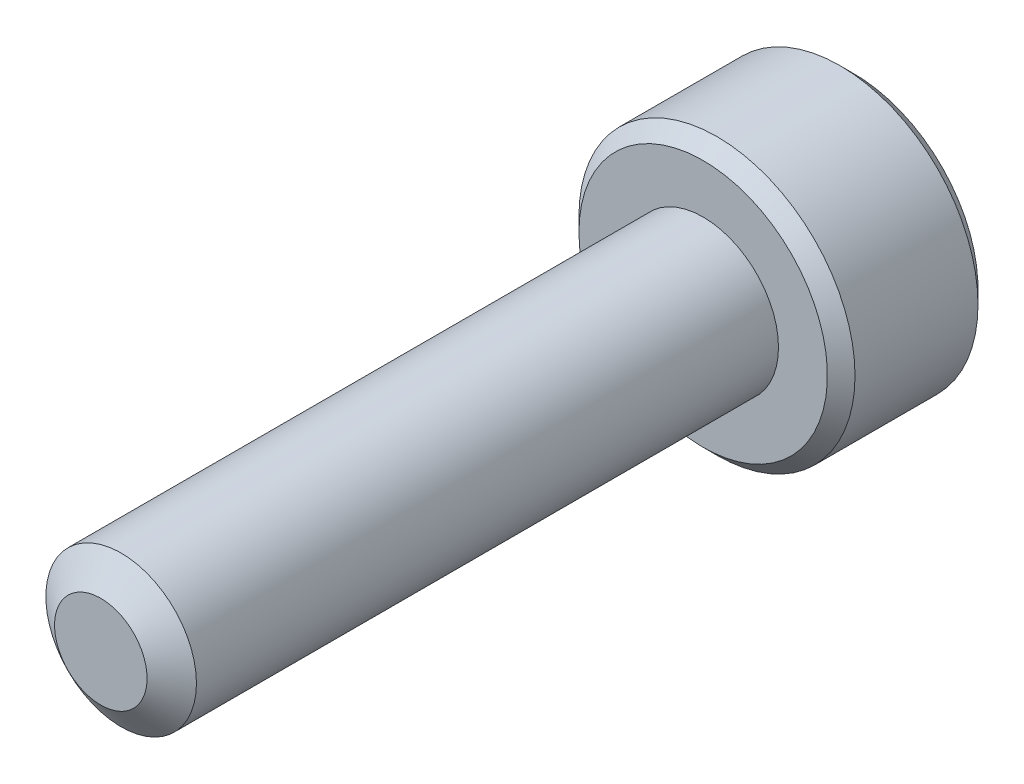
from build123d import *

# Parameters (mm, degrees)
SKETCH1_R          = 1.5
EXTRUDE1_DEPTH     = 12
SKETCH6_R          = 2.75
EXTRUDE2_DEPTH     = 3
CUT_EXTRUDE1_DEPTH = 1.875
CHAMFER1_SIZE      = 0.275


with BuildPart() as part:
    # Sketch1 → Extrude1 (new body)
    with BuildSketch(Plane.XY):
        Circle(SKETCH1_R)
    extrude(amount=-EXTRUDE1_DEPTH)

    # Sketch4 → Cut-Revolve1 (revolve, cut)
    with BuildSketch(Plane(origin=(0, 0, 0), x_dir=(0, 0, -1), z_dir=(1, 0, 0))):
        Polygon((0.405251783, 1.5), (0, 0.921240474), (0, 1.5), align=None)
    revolve(axis=Axis((0, 0, 0), (0, 0, -1)), mode=Mode.SUBTRACT)

    # Sketch6 → Extrude2 (add)
    with BuildSketch(Plane(origin=(0, 0, -12), x_dir=(-1, 0, 0), z_dir=(0, 0, -1))):
        Circle(SKETCH6_R)
    extrude(amount=EXTRUDE2_DEPTH)

    # Sketch7 → Cut-Extrude1 (cut)
    with BuildSketch(Plane(origin=(0, 0, -15), x_dir=(-1, 0, 0), z_dir=(0, 0, -1))):
        Polygon((0, 1.443375673), (-1.25, 0.721687836), (-1.25, -0.721687836), (0, -1.443375673), (1.25, -0.721687836), (1.25, 0.721687836), align=None)
    extrude(amount=-CUT_EXTRUDE1_DEPTH, mode=Mode.SUBTRACT)

    # Cut-Extrude2 cone 1 section (through the dimple's axis) → Cut-Extrude2 (revolve, cut)
    with BuildSketch(Plane(origin=(0, 0, -15), x_dir=(0, 1, 0), z_dir=(1, 0, 0))):
        Polygon((0, 0), (1.443375673, 0), (0, 1.443375673), align=None)
    revolve(axis=Axis((0, 0, -15), (0, 0, 1)), mode=Mode.SUBTRACT)

    # Chamfer1
    chamfer1_edges = [part.edges().sort_by_distance(p)[0] for p in [
        (2.75, 0, -15),
        (2.75, 0, -12),
    ]]
    chamfer(chamfer1_edges, length=CHAMFER1_SIZE)


solid = part.part
